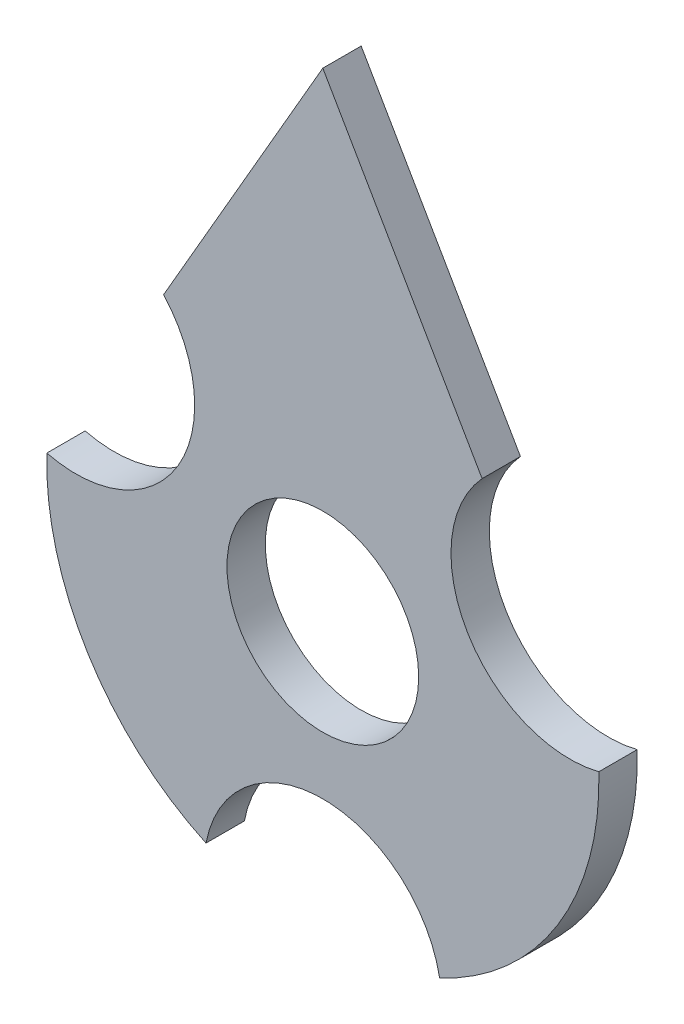
from build123d import *

# Parameters (mm, degrees)
SKETCH1_R           = 25
BOSS_EXTRUDE1_DEPTH = 5


with BuildPart() as part:
    # Sketch1 → Boss-Extrude1 (new, symmetric)
    with BuildSketch(Plane.XY):
        with BuildLine():
            Line((0, 125), (-41.530184947, 53.067609624))
            ThreePointArc((-41.530184947, 53.067609624), (-37.802816798, 16.266321392), (-71.969551168, 2.093729837))
            ThreePointArc((-71.969551168, 2.093729837), (-61.289441892, -37.783651393), (-30.460070741, -65.23943662))
            ThreePointArc((-30.460070741, -65.23943662), (0, -40), (30.460070741, -65.23943662))
            ThreePointArc((30.460070741, -65.23943662), (61.289441892, -37.783651393), (71.969551168, 2.093729837))
            ThreePointArc((71.969551168, 2.093729837), (37.802816798, 16.266321392), (41.530184947, 53.067609624))
            Line((41.530184947, 53.067609624), (0, 125))
        make_face()
        Circle(SKETCH1_R, mode=Mode.SUBTRACT)
    extrude(amount=BOSS_EXTRUDE1_DEPTH, both=True)


solid = part.part
